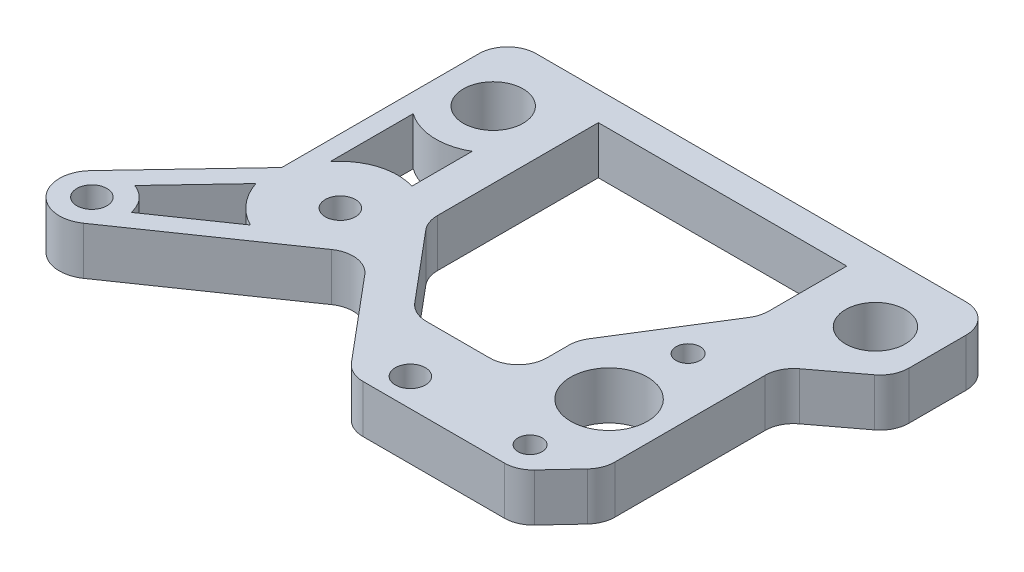
from build123d import *

# Parameters (mm, degrees)
SKETCH4_R           = 3
SKETCH4_R_2         = 3.96875
SKETCH4_R_3         = 5.1
SKETCH4_R_4         = 1.6
SKETCH4_R_5         = 2
BOSS_EXTRUDE2_DEPTH = 6.35
SKETCH11_R          = 3
BOSS_EXTRUDE4_DEPTH = 3.35
SKETCH12_R          = 2
CUT_EXTRUDE1_DEPTH  = 65.17061253


with BuildPart() as part:
    # Sketch4 → Boss-Extrude2 (new body)
    with BuildSketch(Plane(origin=(0, 0, 0), x_dir=(1, 0, 0), z_dir=(0, 1, 0))):
        with BuildLine():
            Line((40.257702493, -18.4375), (21.46596982, -18.4375))
            ThreePointArc((21.46596982, -18.4375), (19.855794242, -18.080532669), (18.547340491, -17.076520793))
            Line((18.547340491, -17.076520793), (9.268629328, -6.01858343))
            ThreePointArc((9.268629328, -6.01858343), (6.86044471, -4.691952465), (4.186444468, -5.331503545))
            Line((4.186444468, -5.331503545), (-15.327970397, -18.794247435))
            ThreePointArc((-15.327970397, -18.794247435), (-21.058470009, -18.050117151), (-20.917416467, -12.27322702))
            Line((-20.917416467, -12.27322702), (-8.5725, 0.781747009))
            Line((-8.5725, 0.781747009), (-8.5725, 26.9875))
            ThreePointArc((-8.5725, 26.9875), (-7.456576836, 29.681576836), (-4.7625, 30.7975))
            Line((-4.7625, 30.7975), (52.3875, 30.7975))
            ThreePointArc((52.3875, 30.7975), (55.081576836, 29.681576836), (56.1975, 26.9875))
            Line((56.1975, 26.9875), (56.1975, 19.362095927))
            ThreePointArc((56.1975, 19.362095927), (55.797199918, 17.662082259), (54.680415238, 16.319294633))
            Line((54.680415238, 16.319294633), (48.985566477, 12.027918285))
            ThreePointArc((48.985566477, 12.027918285), (47.868781798, 10.685130659), (47.468481715, 8.985116992))
            Line((47.468481715, 8.985116992), (47.468481715, -10.980610773))
            ThreePointArc((47.468481715, -10.980610773), (47.203372649, -12.376980446), (46.444939319, -13.579024524))
            Line((46.444939319, -13.579024524), (43.044160097, -17.225913752))
            ThreePointArc((43.044160097, -17.225913752), (41.776936446, -18.121498883), (40.257702493, -18.4375))
        make_face()
        Circle(SKETCH4_R, mode=Mode.SUBTRACT)
        with Locations((-1.5875, 21.9075)):
            Circle(SKETCH4_R_2, mode=Mode.SUBTRACT)
        with Locations((49.2125, 21.9075)):
            Circle(SKETCH4_R_2, mode=Mode.SUBTRACT)
        with Locations((39.848481715, -4.1275)):
            Circle(SKETCH4_R_3, mode=Mode.SUBTRACT)
        with Locations((39.848481715, -14.6275)):
            Circle(SKETCH4_R_4, mode=Mode.SUBTRACT)
        with Locations((39.848481715, 6.3725)):
            Circle(SKETCH4_R_4, mode=Mode.SUBTRACT)
        with Locations((24.012521227, -14.703599027)):
            Circle(SKETCH4_R_5, mode=Mode.SUBTRACT)
        with Locations((-17.78, -15.24)):
            Circle(SKETCH4_R_5, mode=Mode.SUBTRACT)
        with BuildLine():
            Line((40.3225, 26.9875), (40.3225, 16.611657969))
            ThreePointArc((40.3225, 16.611657969), (40.174907062, 15.561479644), (39.743563246, 14.592665573))
            Line((39.743563246, 14.592665573), (31.537418469, 1.460088735))
            ThreePointArc((31.537418469, 1.460088735), (31.106074654, 0.491274664), (30.958481715, -0.558903662))
            Line((30.958481715, -0.558903662), (30.958481715, -3.507298313))
            ThreePointArc((30.958481715, -3.507298313), (29.842558552, -6.20137515), (27.148481715, -7.317298313))
            Line((27.148481715, -7.317298313), (18.766481715, -7.317298313))
            ThreePointArc((18.766481715, -7.317298313), (17.156306138, -6.960330982), (15.847852387, -5.956319106))
            Line((15.847852387, -5.956319106), (8.193870672, 3.165341101))
            ThreePointArc((8.193870672, 3.165341101), (7.532271115, 4.311265148), (7.3025, 5.614361894))
            Line((7.3025, 5.614361894), (7.3025, 26.9875))
            Line((7.3025, 26.9875), (40.3225, 26.9875))
        make_face(mode=Mode.SUBTRACT)
        with BuildLine():
            Line((-13.417009712, -14.390093684), (-4.038317295, -7.919854381))
            ThreePointArc((-4.038317295, -7.919854381), (-6.749791195, -5.78553531), (-8.444304622, -2.779535833))
            Line((-8.444304622, -2.779535833), (-16.272811714, -11.058324681))
            ThreePointArc((-16.272811714, -11.058324681), (-14.405104402, -12.347232345), (-13.417009712, -14.390093684))
        make_face(mode=Mode.SUBTRACT)
        with BuildLine():
            Line((2.2225, 7.28868258), (2.2225, 15.308386423))
            ThreePointArc((2.2225, 15.308386423), (-1.965402874, 14.296876542), (-6.0325, 15.718285591))
            Line((-6.0325, 15.718285591), (-6.0325, 4.65546386))
            ThreePointArc((-6.0325, 4.65546386), (-2.315704041, 7.259608446), (2.2225, 7.28868258))
        make_face(mode=Mode.SUBTRACT)
    extrude(amount=-BOSS_EXTRUDE2_DEPTH)

    # Sketch11 → Boss-Extrude4 (add)
    with BuildSketch(Plane(origin=(0, 0, 0), x_dir=(1, 0, 0), z_dir=(0, 1, 0))):
        Circle(SKETCH11_R)
    extrude(amount=-BOSS_EXTRUDE4_DEPTH)

    # Sketch12 → Cut-Extrude1 (cut, through all)
    with BuildSketch(Plane.XZ.offset(3.35)):
        Circle(SKETCH12_R)
    extrude(amount=-CUT_EXTRUDE1_DEPTH, mode=Mode.SUBTRACT)


solid = part.part
